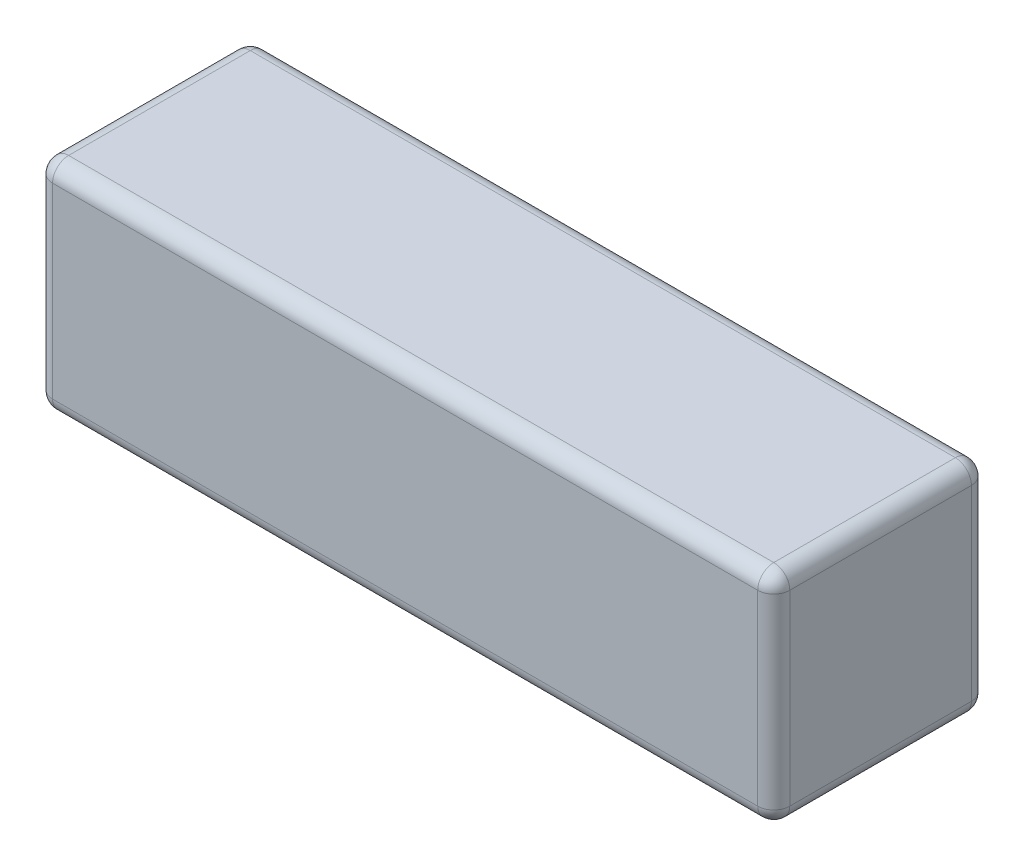
from build123d import *

# Parameters (mm, degrees)
SKETCH_1_W      = 138
SKETCH_1_H      = 41
EXTRUDE_1_DEPTH = 40
FILLET_1_R      = 3


with BuildPart() as part:
    # 草图1 → 凸台-拉伸1 (new body)
    with BuildSketch(Plane.XY):
        Rectangle(SKETCH_1_W, SKETCH_1_H)
    extrude(amount=EXTRUDE_1_DEPTH)

    # 圆角1
    fillet_1_edges = [part.edges().sort_by_distance(p)[0] for p in [
        (-69, 20.5, 20),
        (0, 20.5, 0),
        (-69, 0, 0),
        (-69, -20.5, 20),
        (0, -20.5, 0),
        (69, -20.5, 20),
        (69, 20.5, 20),
        (69, 0, 0),
        (0, 20.5, 40),
        (69, 0, 40),
        (0, -20.5, 40),
        (-69, 0, 40),
    ]]
    fillet(fillet_1_edges, radius=FILLET_1_R)


solid = part.part
